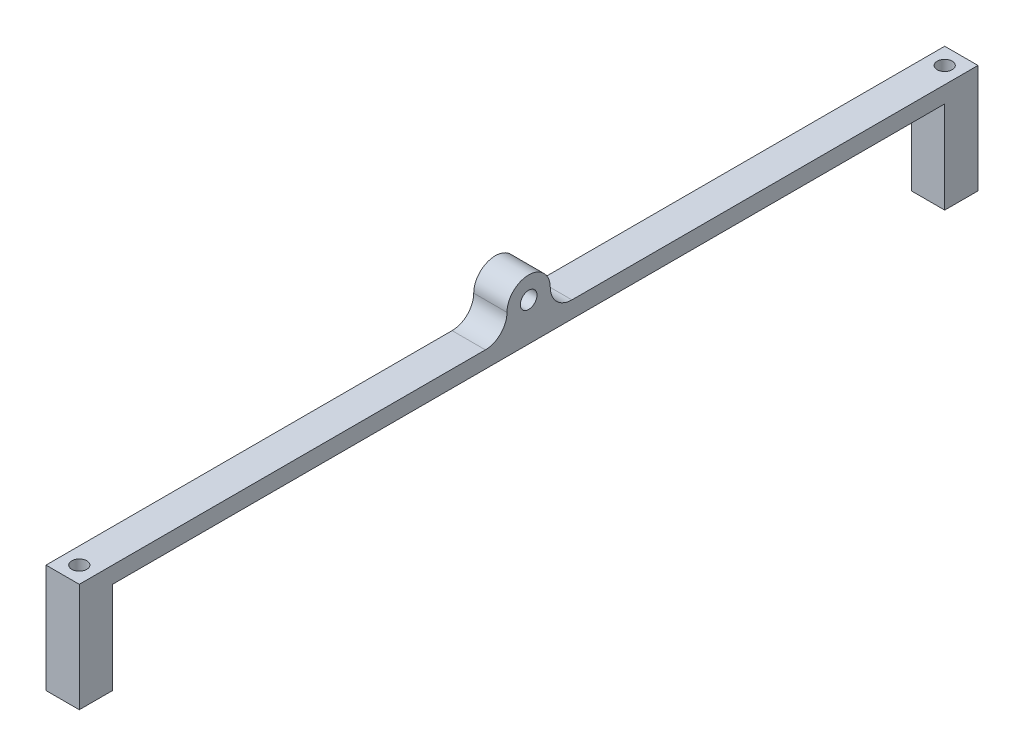
from build123d import *

# Parameters (mm, degrees)
SKETCH_1_W      = 10
SKETCH_1_H      = 270
SKETCH_1_R      = 2.25
EXTRUDE_1_DEPTH = 5
SKETCH_2_R      = 2.5
EXTRUDE_2_DEPTH = 10
EXTRUDE_START   = 27.65
SKETCH_3_W      = 10
SKETCH_3_H      = 10
SKETCH_3_R      = 2.25
EXTRUDE_3_DEPTH = 27.65


with BuildPart() as part:
    # Эскиз1 → Бобышка-Вытянуть1 (new body)
    with BuildSketch(Plane(origin=(0, 0, 0), x_dir=(1, 0, 0), z_dir=(0, 1, 0))):
        with Locations((5, 135)):
            Rectangle(SKETCH_1_W, SKETCH_1_H)
        with Locations((5, 265)):
            Circle(SKETCH_1_R, mode=Mode.SUBTRACT)
        with Locations((5, 5)):
            Circle(SKETCH_1_R, mode=Mode.SUBTRACT)
    extrude(amount=EXTRUDE_1_DEPTH)

    # Эскиз2 → Бобышка-Вытянуть2 (add)
    with BuildSketch(Plane(origin=(0, 0, 0), x_dir=(0, 0, -1), z_dir=(1, 0, 0))):
        with BuildLine():
            Line((122, 5), (148, 5))
            ThreePointArc((148, 5), (143.403805922, 6.903805922), (141.5, 11.5))
            ThreePointArc((141.5, 11.5), (135, 18), (128.5, 11.5))
            ThreePointArc((128.5, 11.5), (126.596194078, 6.903805922), (122, 5))
        make_face()
        with Locations((135, 11.5)):
            Circle(SKETCH_2_R, mode=Mode.SUBTRACT)
    extrude(amount=EXTRUDE_2_DEPTH)

    # Эскиз3 → Бобышка-Вытянуть3 (add)
    # profile 1 of 2: a face of its own
    with BuildSketch(Plane.XZ.offset(EXTRUDE_START)):
        with Locations((5, -5)):
            Rectangle(SKETCH_3_W, SKETCH_3_H)
        with Locations((5, -5)):
            Circle(SKETCH_3_R, mode=Mode.SUBTRACT)
    # profile 2 of 2: a face of its own
    with BuildSketch(Plane.XZ.offset(EXTRUDE_START)):
        with Locations((5, -265)):
            Rectangle(SKETCH_3_W, SKETCH_3_H)
        with Locations((5, -265)):
            Circle(SKETCH_3_R, mode=Mode.SUBTRACT)
    extrude(amount=-EXTRUDE_3_DEPTH)


solid = part.part
